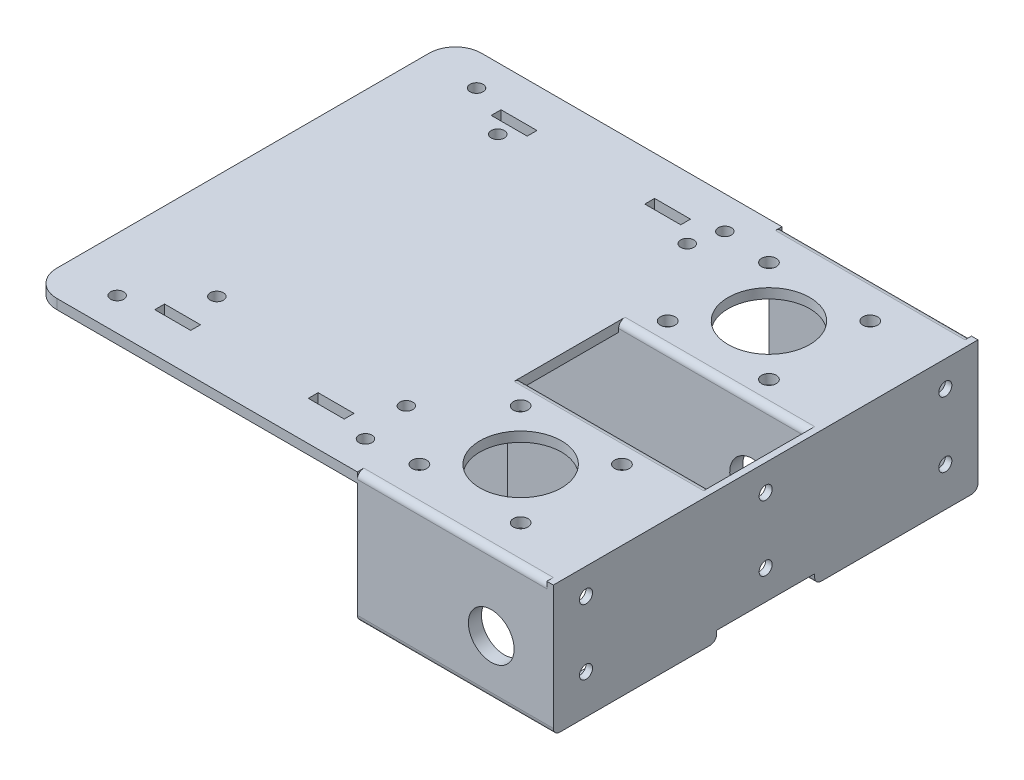
from build123d import *

# Parameters (mm, degrees)
EXTRUDE_1_DEPTH                 = 60
EXTRUDE_1_2_DEPTH               = 60
CUT_EXTRUDE_START               = -3.145949
SKETCH_2_R                      = 2.25
SKETCH_2_R_2                    = 12.5
CUT_EXTRUDE_1_DEPTH             = 3.145949
CUT_EXTRUDE_2_DEPTH             = 108.703296236
CUT_EXTRUDE_2_DEPTH_BACK        = 108.703296236
SKETCH_3_R                      = 7
SKETCH_6_W                      = 100
SKETCH_6_H                      = 130
EXTRUDE_3_DEPTH                 = 3
CUT_EXTRUDE_3_REACH             = 136.164
SKETCH_9_R                      = 2
CUT_EXTRUDE_7_REACH             = 136.164
SKETCH_19_R                     = 2
CUT_EXTRUDE_7_DIRECTION_2_DEPTH = 135.16407865
CUT_EXTRUDE_5_REACH             = 136.164
SKETCH_16_W                     = 11
SKETCH_16_H                     = 3
CUT_EXTRUDE_4_REACH             = 136.164
SKETCH_13_W                     = 45
SKETCH_13_H                     = 40
SKETCH_7_W                      = 2
SKETCH_7_H                      = 37
EXTRUDE_4_DEPTH                 = 100
SKETCH_8_W                      = 70
SKETCH_8_H                      = 34
EXTRUDE_5_DEPTH                 = 3
FILLET_1_R                      = 8
SKETCH_14_W                     = 43
SKETCH_14_H                     = 5
EXTRUDE_8_DEPTH                 = 1
SKETCH_17_R                     = 1.5
CUT_EXTRUDE_6_DEPTH             = 3
SKETCH_18_W                     = 130
SKETCH_18_H                     = 37
EXTRUDE_9_DEPTH                 = 2
CUT_EXTRUDE_8_REACH             = 185.303
SKETCH_20_R                     = 2
FILLET_2_R                      = 5


with BuildPart() as part:
    # 草图1 → 凸台-拉伸1 (new body)
    with BuildSketch(Plane(origin=(0, 0, 0), x_dir=(0, 0, -1), z_dir=(1, 0, 0))):
        with BuildLine():
            Line((50, 2), (50, 38))
            ThreePointArc((50, 38), (49.414213562, 39.414213562), (48, 40))
            Line((48, 40), (2, 40))
            ThreePointArc((2, 40), (0.585786438, 39.414213562), (0, 38))
            Line((0, 38), (0, 2))
            ThreePointArc((0, 2), (0.585786438, 0.585786438), (2, 0))
            Line((2, 0), (48, 0))
            ThreePointArc((48, 0), (49.414213562, 0.585786438), (50, 2))
        make_face()
        with BuildLine():
            Line((4, 5), (4, 35))
            ThreePointArc((4, 35), (4.585786438, 36.414213562), (6, 37))
            Line((6, 37), (44, 37))
            ThreePointArc((44, 37), (45.414213562, 36.414213562), (46, 35))
            Line((46, 35), (46, 5))
            ThreePointArc((46, 5), (45.414213562, 3.585786438), (44, 3))
            Line((44, 3), (6, 3))
            ThreePointArc((6, 3), (4.585786438, 3.585786438), (4, 5))
        make_face(mode=Mode.SUBTRACT)
    extrude(amount=EXTRUDE_1_DEPTH)


with BuildPart() as body_2:
    # 草图1 → Extrude 1 2 (new body)
    with BuildSketch(Plane(origin=(0, 0, 0), x_dir=(0, 0, -1), z_dir=(1, 0, 0))):
        with BuildLine():
            Line((-78, 0), (-32, 0))
            ThreePointArc((-32, 0), (-30.585786438, 0.585786438), (-30, 2))
            Line((-30, 2), (-30, 38))
            ThreePointArc((-30, 38), (-30.585786438, 39.414213562), (-32, 40))
            Line((-32, 40), (-78, 40))
            ThreePointArc((-78, 40), (-79.414213562, 39.414213562), (-80, 38))
            Line((-80, 38), (-80, 2))
            ThreePointArc((-80, 2), (-79.414213562, 0.585786438), (-78, 0))
        make_face()
        with BuildLine():
            Line((-74, 3), (-36, 3))
            ThreePointArc((-36, 3), (-34.585786438, 3.585786438), (-34, 5))
            Line((-34, 5), (-34, 35))
            ThreePointArc((-34, 35), (-34.585786438, 36.414213562), (-36, 37))
            Line((-36, 37), (-74, 37))
            ThreePointArc((-74, 37), (-75.414213562, 36.414213562), (-76, 35))
            Line((-76, 35), (-76, 5))
            ThreePointArc((-76, 5), (-75.414213562, 3.585786438), (-74, 3))
        make_face(mode=Mode.SUBTRACT)
    extrude(amount=EXTRUDE_1_2_DEPTH)


with BuildPart() as cut_extrude_1_tool:
    # 草图2 → 切除-拉伸1 (new body)
    with BuildSketch(Plane(origin=(0, 40, 0), x_dir=(1, 0, 0), z_dir=(0, 1, 0)).offset(CUT_EXTRUDE_START)):
        with Locations(Location((7.5, 7.5, 0), (0, 0, 270))):
            Circle(SKETCH_2_R)
        with Locations(Location((38.5, 7.5, 0), (0, 0, 270))):
            Circle(SKETCH_2_R)
        with Locations(Location((38.5, 38.5, 0), (0, 0, 270))):
            Circle(SKETCH_2_R)
        with Locations(Location((7.5, 38.5, 0), (0, 0, 270))):
            Circle(SKETCH_2_R)
        with Locations(Location((23, 23, 0), (0, 0, 270))):
            Circle(SKETCH_2_R_2)
        with Locations(Location((23, -53, 0), (0, 0, 90))):
            Circle(SKETCH_2_R_2)
        with Locations(Location((7.5, -68.5, 0), (0, 0, 90))):
            Circle(SKETCH_2_R)
        with Locations(Location((38.5, -68.5, 0), (0, 0, 90))):
            Circle(SKETCH_2_R)
        with Locations(Location((38.5, -37.5, 0), (0, 0, 138.189685104))):
            Circle(SKETCH_2_R)
        with Locations(Location((7.5, -37.5, 0), (0, 0, 138.189685104))):
            Circle(SKETCH_2_R)
    extrude(amount=CUT_EXTRUDE_1_DEPTH)


with BuildPart() as part_1:
    add(part.part)

    # 切除-拉伸1: cut by cut_extrude_1_tool
    add(cut_extrude_1_tool.part, mode=Mode.SUBTRACT)


with BuildPart() as body_2_1:
    add(body_2.part)

    # 切除-拉伸1: cut by cut_extrude_1_tool
    add(cut_extrude_1_tool.part, mode=Mode.SUBTRACT)


with BuildPart() as cut_extrude_2_tool:
    # 草图3 → 切除-拉伸2 (new, two sides: drawn at the far end of the back side and taken through both)
    with BuildSketch(Plane.XY.offset(-CUT_EXTRUDE_2_DEPTH_BACK)):
        with Locations((41, 17)):
            Circle(SKETCH_3_R)
    extrude(amount=CUT_EXTRUDE_2_DEPTH + CUT_EXTRUDE_2_DEPTH_BACK)


with BuildPart() as part_2:
    add(part_1.part)

    # 切除-拉伸2: cut by cut_extrude_2_tool
    add(cut_extrude_2_tool.part, mode=Mode.SUBTRACT)



with BuildPart() as body_2_2:
    add(body_2_1.part)

    # 切除-拉伸2: cut by cut_extrude_2_tool
    add(cut_extrude_2_tool.part, mode=Mode.SUBTRACT)


with BuildPart() as part_3:
    add(part_2.part)

    add(body_2_2.part)  # 凸台-拉伸3 merges body 2
    # 草图6 → 凸台-拉伸3 (add)
    with BuildSketch(Plane(origin=(0, 40, 0), x_dir=(1, 0, 0), z_dir=(0, 1, 0))):
        with Locations((-50, -15)):
            Rectangle(SKETCH_6_W, SKETCH_6_H)
    extrude(amount=-EXTRUDE_3_DEPTH)

    # 草图9 → 切除-拉伸3 (cut, up to next)
    with BuildSketch(Plane(origin=(0, 40, 0), x_dir=(1, 0, 0), z_dir=(0, 1, 0)), mode=Mode.PRIVATE) as cut_extrude_3_sk1:
        with Locations(Location((-68, 31, 0), (0, 0, 270))):
            Circle(SKETCH_9_R)
    cut_extrude_3_tool1 = extrude(cut_extrude_3_sk1.sketch, amount=-CUT_EXTRUDE_3_REACH, mode=Mode.PRIVATE) & part_3.part
    # 草图9 → 切除-拉伸3 (cut, up to next)
    with BuildSketch(Plane(origin=(0, 40, 0), x_dir=(1, 0, 0), z_dir=(0, 1, 0)), mode=Mode.PRIVATE) as cut_extrude_3_sk2:
        with Locations(Location((-68, -55, 0), (0, 0, 270))):
            Circle(SKETCH_9_R)
    cut_extrude_3_tool2 = extrude(cut_extrude_3_sk2.sketch, amount=-CUT_EXTRUDE_3_REACH, mode=Mode.PRIVATE) & part_3.part
    # 草图9 → 切除-拉伸3 (cut, up to next)
    with BuildSketch(Plane(origin=(0, 40, 0), x_dir=(1, 0, 0), z_dir=(0, 1, 0)), mode=Mode.PRIVATE) as cut_extrude_3_sk3:
        with Locations(Location((-10, 31, 0), (0, 0, 270))):
            Circle(SKETCH_9_R)
    cut_extrude_3_tool3 = extrude(cut_extrude_3_sk3.sketch, amount=-CUT_EXTRUDE_3_REACH, mode=Mode.PRIVATE) & part_3.part
    # 草图9 → 切除-拉伸3 (cut, up to next)
    with BuildSketch(Plane(origin=(0, 40, 0), x_dir=(1, 0, 0), z_dir=(0, 1, 0)), mode=Mode.PRIVATE) as cut_extrude_3_sk4:
        with Locations(Location((-10, -55, 0), (0, 0, 270))):
            Circle(SKETCH_9_R)
    cut_extrude_3_tool4 = extrude(cut_extrude_3_sk4.sketch, amount=-CUT_EXTRUDE_3_REACH, mode=Mode.PRIVATE) & part_3.part
    add(cut_extrude_3_tool1.solids().sort_by_distance((-68, 40, -31))[0], mode=Mode.SUBTRACT)
    add(cut_extrude_3_tool2.solids().sort_by_distance((-68, 40, 55))[0], mode=Mode.SUBTRACT)
    add(cut_extrude_3_tool3.solids().sort_by_distance((-10, 40, -31))[0], mode=Mode.SUBTRACT)
    add(cut_extrude_3_tool4.solids().sort_by_distance((-10, 40, 55))[0], mode=Mode.SUBTRACT)

    # 草图19 → 切除-拉伸7 (cut, up to next)
    with BuildSketch(Plane(origin=(0, 40, 0), x_dir=(1, 0, 0), z_dir=(0, 1, 0)), mode=Mode.PRIVATE) as cut_extrude_7_sk1:
        with Locations(Location((-83.5, 40, 0), (0, 0, 90))):
            Circle(SKETCH_19_R)
    cut_extrude_7_tool1 = extrude(cut_extrude_7_sk1.sketch, amount=-CUT_EXTRUDE_7_REACH, mode=Mode.PRIVATE) & part_3.part
    # 草图19 → 切除-拉伸7 (cut, up to next)
    with BuildSketch(Plane(origin=(0, 40, 0), x_dir=(1, 0, 0), z_dir=(0, 1, 0)), mode=Mode.PRIVATE) as cut_extrude_7_sk2:
        with Locations(Location((-7.5, 40, 0), (0, 0, 90))):
            Circle(SKETCH_19_R)
    cut_extrude_7_tool2 = extrude(cut_extrude_7_sk2.sketch, amount=-CUT_EXTRUDE_7_REACH, mode=Mode.PRIVATE) & part_3.part
    # 草图19 → 切除-拉伸7 (cut, up to next)
    with BuildSketch(Plane(origin=(0, 40, 0), x_dir=(1, 0, 0), z_dir=(0, 1, 0)), mode=Mode.PRIVATE) as cut_extrude_7_sk3:
        with Locations(Location((-7.5, -70, 0), (0, 0, 90))):
            Circle(SKETCH_19_R)
    cut_extrude_7_tool3 = extrude(cut_extrude_7_sk3.sketch, amount=-CUT_EXTRUDE_7_REACH, mode=Mode.PRIVATE) & part_3.part
    # 草图19 → 切除-拉伸7 (cut, up to next)
    with BuildSketch(Plane(origin=(0, 40, 0), x_dir=(1, 0, 0), z_dir=(0, 1, 0)), mode=Mode.PRIVATE) as cut_extrude_7_sk4:
        with Locations(Location((-83.5, -70, 0), (0, 0, 90))):
            Circle(SKETCH_19_R)
    cut_extrude_7_tool4 = extrude(cut_extrude_7_sk4.sketch, amount=-CUT_EXTRUDE_7_REACH, mode=Mode.PRIVATE) & part_3.part
    add(cut_extrude_7_tool1.solids().sort_by_distance((-83.5, 40, -40))[0], mode=Mode.SUBTRACT)
    add(cut_extrude_7_tool2.solids().sort_by_distance((-7.5, 40, -40))[0], mode=Mode.SUBTRACT)
    add(cut_extrude_7_tool3.solids().sort_by_distance((-7.5, 40, 70))[0], mode=Mode.SUBTRACT)
    add(cut_extrude_7_tool4.solids().sort_by_distance((-83.5, 40, 70))[0], mode=Mode.SUBTRACT)

    # 草图19 → 切除-拉伸7 direction 2 (cut)
    with BuildSketch(Plane(origin=(0, 40, 0), x_dir=(1, 0, 0), z_dir=(0, 1, 0))):
        with Locations(Location((-83.5, 40, 0), (0, 0, 90))):
            Circle(SKETCH_19_R)
        with Locations(Location((-7.5, 40, 0), (0, 0, 90))):
            Circle(SKETCH_19_R)
        with Locations(Location((-7.5, -70, 0), (0, 0, 90))):
            Circle(SKETCH_19_R)
        with Locations(Location((-83.5, -70, 0), (0, 0, 90))):
            Circle(SKETCH_19_R)
    extrude(amount=CUT_EXTRUDE_7_DIRECTION_2_DEPTH, mode=Mode.SUBTRACT)

    # 草图16 → 切除-拉伸5 (cut, up to next)
    with BuildSketch(Plane(origin=(0, 40, 0), x_dir=(1, 0, 0), z_dir=(0, 1, 0)), mode=Mode.PRIVATE) as cut_extrude_5_sk1:
        with Locations((-21.5, 36.5)):
            Rectangle(SKETCH_16_W, SKETCH_16_H)
    cut_extrude_5_tool1 = extrude(cut_extrude_5_sk1.sketch, amount=-CUT_EXTRUDE_5_REACH, mode=Mode.PRIVATE) & part_3.part
    # 草图16 → 切除-拉伸5 (cut, up to next)
    with BuildSketch(Plane(origin=(0, 40, 0), x_dir=(1, 0, 0), z_dir=(0, 1, 0)), mode=Mode.PRIVATE) as cut_extrude_5_sk2:
        with Locations((-68.5, 36.5)):
            Rectangle(SKETCH_16_W, SKETCH_16_H)
    cut_extrude_5_tool2 = extrude(cut_extrude_5_sk2.sketch, amount=-CUT_EXTRUDE_5_REACH, mode=Mode.PRIVATE) & part_3.part
    # 草图16 → 切除-拉伸5 (cut, up to next)
    with BuildSketch(Plane(origin=(0, 40, 0), x_dir=(1, 0, 0), z_dir=(0, 1, 0)), mode=Mode.PRIVATE) as cut_extrude_5_sk3:
        with Locations((-68.5, -66.5)):
            Rectangle(SKETCH_16_W, SKETCH_16_H)
    cut_extrude_5_tool3 = extrude(cut_extrude_5_sk3.sketch, amount=-CUT_EXTRUDE_5_REACH, mode=Mode.PRIVATE) & part_3.part
    # 草图16 → 切除-拉伸5 (cut, up to next)
    with BuildSketch(Plane(origin=(0, 40, 0), x_dir=(1, 0, 0), z_dir=(0, 1, 0)), mode=Mode.PRIVATE) as cut_extrude_5_sk4:
        with Locations((-21.5, -66.5)):
            Rectangle(SKETCH_16_W, SKETCH_16_H)
    cut_extrude_5_tool4 = extrude(cut_extrude_5_sk4.sketch, amount=-CUT_EXTRUDE_5_REACH, mode=Mode.PRIVATE) & part_3.part
    add(cut_extrude_5_tool1.solids().sort_by_distance((-21.5, 40, -36.5))[0], mode=Mode.SUBTRACT)
    add(cut_extrude_5_tool2.solids().sort_by_distance((-68.5, 40, -36.5))[0], mode=Mode.SUBTRACT)
    add(cut_extrude_5_tool3.solids().sort_by_distance((-68.5, 40, 66.5))[0], mode=Mode.SUBTRACT)
    add(cut_extrude_5_tool4.solids().sort_by_distance((-21.5, 40, 66.5))[0], mode=Mode.SUBTRACT)

    # 草图13 → 切除-拉伸4 (cut, up to next)
    with BuildSketch(Plane.XZ, mode=Mode.PRIVATE) as cut_extrude_4_sk1:
        with Locations((27.5, -24)):
            Rectangle(SKETCH_13_W, SKETCH_13_H)
    cut_extrude_4_tool1 = extrude(cut_extrude_4_sk1.sketch, amount=-CUT_EXTRUDE_4_REACH, mode=Mode.PRIVATE) & part_3.part
    # 草图13 → 切除-拉伸4 (cut, up to next)
    with BuildSketch(Plane.XZ, mode=Mode.PRIVATE) as cut_extrude_4_sk2:
        with Locations((27.5, 54)):
            Rectangle(SKETCH_13_W, SKETCH_13_H)
    cut_extrude_4_tool2 = extrude(cut_extrude_4_sk2.sketch, amount=-CUT_EXTRUDE_4_REACH, mode=Mode.PRIVATE) & part_3.part
    add(cut_extrude_4_tool1.solids().sort_by_distance((27.5, 0, -24))[0], mode=Mode.SUBTRACT)
    add(cut_extrude_4_tool2.solids().sort_by_distance((27.5, 0, 54))[0], mode=Mode.SUBTRACT)

    # 草图7 → 凸台-拉伸4 (add)
    with BuildSketch(Plane.ZY):
        with Locations((-1, 18.5)):
            Rectangle(SKETCH_7_W, SKETCH_7_H)
        with Locations((31, 18.5)):
            Rectangle(SKETCH_7_W, SKETCH_7_H)
    extrude(amount=EXTRUDE_4_DEPTH)

    # 草图8 → 凸台-拉伸5 (add)
    with BuildSketch(Plane.XZ):
        with Locations((-65, 15)):
            Rectangle(SKETCH_8_W, SKETCH_8_H)
    extrude(amount=-EXTRUDE_5_DEPTH)

    # 圆角1
    fillet_1_edges = [part_3.edges().sort_by_distance(p)[0] for p in [
        (-100, 38.5, 80),
        (-100, 38.5, -50),
    ]]
    fillet(fillet_1_edges, radius=FILLET_1_R)

    # 草图14 → 凸台-拉伸8 (add)
    with BuildSketch(Plane.ZY):
        with Locations((-25.5, 34.5)):
            Rectangle(SKETCH_14_W, SKETCH_14_H)
        with Locations((55.5, 34.5)):
            Rectangle(SKETCH_14_W, SKETCH_14_H)
    extrude(amount=-EXTRUDE_8_DEPTH)

    # 草图17 → 切除-拉伸6 (cut)
    with BuildSketch(Plane.XZ):
        with Locations(Location((-83, 15, 0), (0, 0, 270))):
            Circle(SKETCH_17_R)
        with Locations(Location((-43, 15, 0), (0, 0, 270))):
            Circle(SKETCH_17_R)
    extrude(amount=-CUT_EXTRUDE_6_DEPTH, mode=Mode.SUBTRACT)

    # 草图18 → 凸台-拉伸9 (add)
    with BuildSketch(Plane(origin=(60, 0, 0), x_dir=(0, 0, -1), z_dir=(1, 0, 0))):
        with Locations((-15, 21.5)):
            Rectangle(SKETCH_18_W, SKETCH_18_H)
    extrude(amount=-EXTRUDE_9_DEPTH)

    # 草图20 → 切除-拉伸8 (cut, up to next)
    with BuildSketch(Plane(origin=(60, 0, 0), x_dir=(0, 0, -1), z_dir=(1, 0, 0)), mode=Mode.PRIVATE) as cut_extrude_8_sk1:
        with Locations((-70, 32)):
            Circle(SKETCH_20_R)
    cut_extrude_8_tool1 = extrude(cut_extrude_8_sk1.sketch, amount=-CUT_EXTRUDE_8_REACH, mode=Mode.PRIVATE) & part_3.part
    # 草图20 → 切除-拉伸8 (cut, up to next)
    with BuildSketch(Plane(origin=(60, 0, 0), x_dir=(0, 0, -1), z_dir=(1, 0, 0)), mode=Mode.PRIVATE) as cut_extrude_8_sk2:
        with Locations((-70, 12)):
            Circle(SKETCH_20_R)
    cut_extrude_8_tool2 = extrude(cut_extrude_8_sk2.sketch, amount=-CUT_EXTRUDE_8_REACH, mode=Mode.PRIVATE) & part_3.part
    # 草图20 → 切除-拉伸8 (cut, up to next)
    with BuildSketch(Plane(origin=(60, 0, 0), x_dir=(0, 0, -1), z_dir=(1, 0, 0)), mode=Mode.PRIVATE) as cut_extrude_8_sk3:
        with Locations((40, 12)):
            Circle(SKETCH_20_R)
    cut_extrude_8_tool3 = extrude(cut_extrude_8_sk3.sketch, amount=-CUT_EXTRUDE_8_REACH, mode=Mode.PRIVATE) & part_3.part
    # 草图20 → 切除-拉伸8 (cut, up to next)
    with BuildSketch(Plane(origin=(60, 0, 0), x_dir=(0, 0, -1), z_dir=(1, 0, 0)), mode=Mode.PRIVATE) as cut_extrude_8_sk4:
        with Locations((40, 32)):
            Circle(SKETCH_20_R)
    cut_extrude_8_tool4 = extrude(cut_extrude_8_sk4.sketch, amount=-CUT_EXTRUDE_8_REACH, mode=Mode.PRIVATE) & part_3.part
    # 草图20 → 切除-拉伸8 (cut, up to next)
    with BuildSketch(Plane(origin=(60, 0, 0), x_dir=(0, 0, -1), z_dir=(1, 0, 0)), mode=Mode.PRIVATE) as cut_extrude_8_sk5:
        with Locations((-15, 32)):
            Circle(SKETCH_20_R)
    cut_extrude_8_tool5 = extrude(cut_extrude_8_sk5.sketch, amount=-CUT_EXTRUDE_8_REACH, mode=Mode.PRIVATE) & part_3.part
    # 草图20 → 切除-拉伸8 (cut, up to next)
    with BuildSketch(Plane(origin=(60, 0, 0), x_dir=(0, 0, -1), z_dir=(1, 0, 0)), mode=Mode.PRIVATE) as cut_extrude_8_sk6:
        with Locations((-15, 12)):
            Circle(SKETCH_20_R)
    cut_extrude_8_tool6 = extrude(cut_extrude_8_sk6.sketch, amount=-CUT_EXTRUDE_8_REACH, mode=Mode.PRIVATE) & part_3.part
    add(cut_extrude_8_tool1.solids().sort_by_distance((60, 32, 70))[0], mode=Mode.SUBTRACT)
    add(cut_extrude_8_tool2.solids().sort_by_distance((60, 12, 70))[0], mode=Mode.SUBTRACT)
    add(cut_extrude_8_tool3.solids().sort_by_distance((60, 12, -40))[0], mode=Mode.SUBTRACT)
    add(cut_extrude_8_tool4.solids().sort_by_distance((60, 32, -40))[0], mode=Mode.SUBTRACT)
    add(cut_extrude_8_tool5.solids().sort_by_distance((60, 32, 15))[0], mode=Mode.SUBTRACT)
    add(cut_extrude_8_tool6.solids().sort_by_distance((60, 12, 15))[0], mode=Mode.SUBTRACT)

    # 圆角2
    # the kernel refuses this fillet: 5 mm, written as the material it adds along each edge
    with BuildSketch(Plane(origin=(-100, 3, 30), x_dir=(0, 1, 0), z_dir=(1, 0, 0))) as fillet_2_piece_1:
        with BuildLine():
            CenterArc((FILLET_2_R, -FILLET_2_R), FILLET_2_R, 90, 90)
            Line((0, -FILLET_2_R), (0, 0))
            Line((0, 0), (FILLET_2_R, 0))
        make_face()
    extrude(amount=70)
    with BuildSketch(Plane(origin=(-30, 3, 0), x_dir=(0, 0, 1), z_dir=(-1, 0, 0))) as fillet_2_piece_2:
        with BuildLine():
            CenterArc((FILLET_2_R, FILLET_2_R), FILLET_2_R, 180, 90)
            Line((0, FILLET_2_R), (0, 0))
            Line((0, 0), (FILLET_2_R, 0))
        make_face()
    extrude(amount=70)
    # the kernel refuses this fillet: 5 mm, written as the material it takes off along each edge
    with BuildSketch(Plane(origin=(-112.5, 0, 32), x_dir=(0, 1, 0), z_dir=(1, 0, 0))) as fillet_2_2_piece_1:
        with BuildLine():
            CenterArc((FILLET_2_R, -FILLET_2_R), FILLET_2_R, 90, 90)
            Line((0, -FILLET_2_R), (0, 0))
            Line((0, 0), (FILLET_2_R, 0))
        make_face()
    extrude(amount=112.5, mode=Mode.SUBTRACT)
    with BuildSketch(Plane(origin=(0, 0, -2), x_dir=(0, 0, 1), z_dir=(-1, 0, 0))) as fillet_2_2_piece_2:
        with BuildLine():
            CenterArc((FILLET_2_R, FILLET_2_R), FILLET_2_R, 180, 90)
            Line((0, FILLET_2_R), (0, 0))
            Line((0, 0), (FILLET_2_R, 0))
        make_face()
    extrude(amount=112.5, mode=Mode.SUBTRACT)


solid = part_3.part
